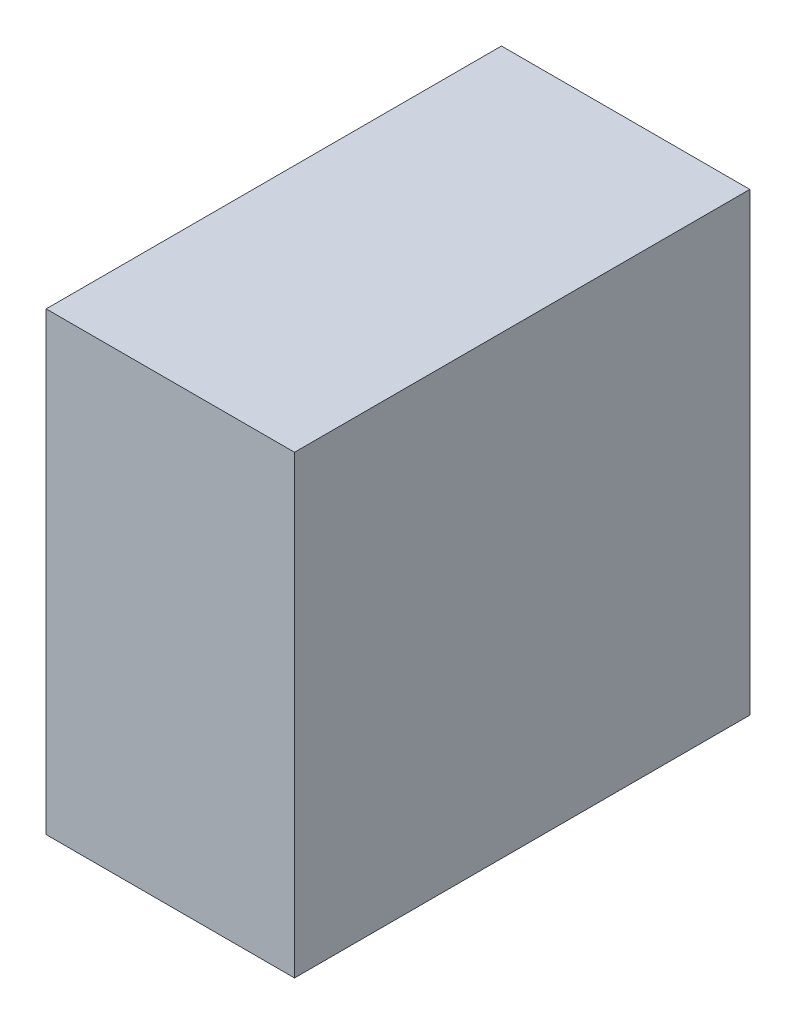
from build123d import *

# Parameters (mm, degrees)
SKETCH_1_W      = 110
SKETCH_1_H      = 110
EXTRUDE_2_DEPTH = 60


with BuildPart() as part:
    # 草图1 → 凸台-拉伸2 (new body)
    with BuildSketch(Plane(origin=(0, 0, 0), x_dir=(0, 0, -1), z_dir=(1, 0, 0))):
        with Locations((1.082247343, -1.799990478)):
            Rectangle(SKETCH_1_W, SKETCH_1_H)
    extrude(amount=EXTRUDE_2_DEPTH)


solid = part.part
